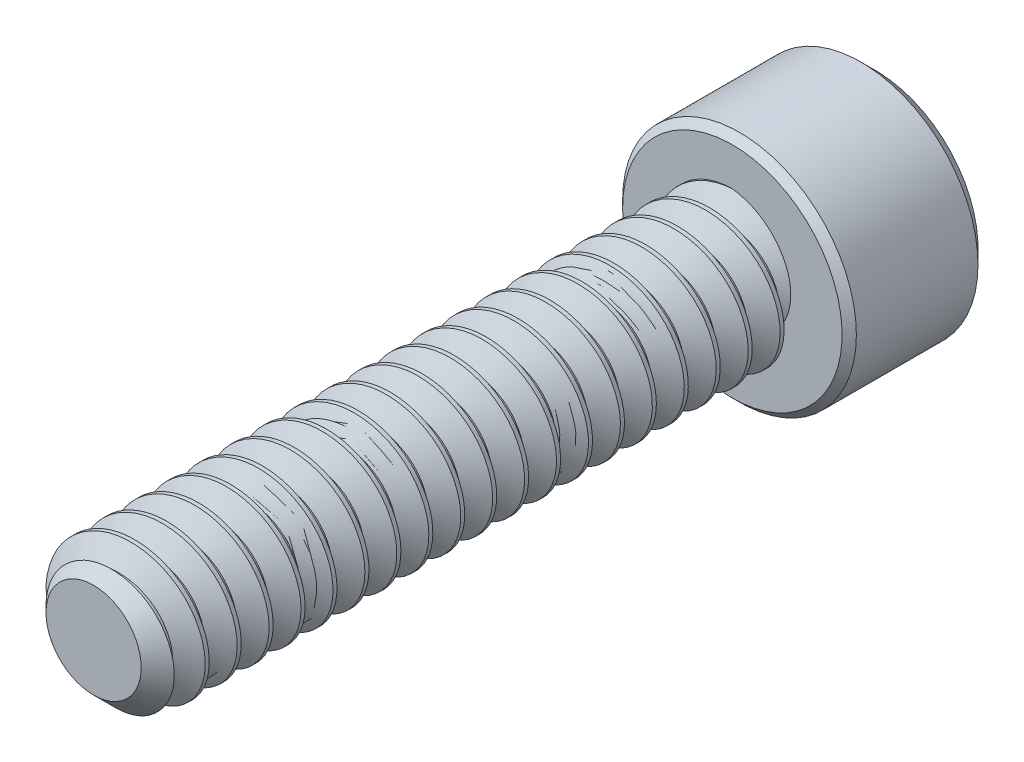
from build123d import *

# Parameters (mm, degrees)
SKETCH1_R          = 1.4224
EXTRUDE1_DEPTH     = 12.7
CHAMFER3_SIZE      = 0.47625
CUT_SWEEP1_PITCH   = 0.635
SKETCH6_R          = 2.3241
EXTRUDE2_DEPTH     = 2.8448
CUT_EXTRUDE1_DEPTH = 1.7859375
SKETCH8_R          = 1.374815329
CUT_EXTRUDE2_DEPTH = 0.28448
CUT_EXTRUDE2_DRAFT = -45
CHAMFER1_SIZE      = 0.28448
CHAMFER2_SIZE      = 0.14224


with BuildPart() as part:
    # Sketch1 → Extrude1 (new body)
    with BuildSketch(Plane.XY):
        Circle(SKETCH1_R)
    extrude(amount=-EXTRUDE1_DEPTH)

    # Chamfer3
    chamfer3_edges = [part.edges().sort_by_distance(p)[0] for p in [
        (-1.4224, 0, 0),
    ]]
    chamfer(chamfer3_edges, length=CHAMFER3_SIZE)

    # Cut-Sweep1: the profile of Sketch3 profile screwed along a right-hand helix of 21 turns, 6 arcs to a turn; built about Z, then put on its axis
    cut_sweep1_z = Axis((0, 0, 0), (0, 0, 1))
    cut_sweep1_corners = [(1.4227, 0, -0.555798205), (1.009955401, 0, -0.3175), (1.009955401, 0, -0.238125), (1.4227, 0, 0.000173205)]
    with BuildLine(mode=Mode.PRIVATE) as cut_sweep1_profile:
        Line(cut_sweep1_corners[0], cut_sweep1_corners[1])
        Line(cut_sweep1_corners[1], cut_sweep1_corners[2])
        Line(cut_sweep1_corners[2], cut_sweep1_corners[3])
        Line(cut_sweep1_corners[3], cut_sweep1_corners[0])
    cut_sweep1_cap = Face(cut_sweep1_profile.wire())
    cut_sweep1_turn_angles = [0, 30, 60, 90, 120, 150, 180, 210, 240, 270, 300, 330, 360]
    cut_sweep1_turn_weights = [1, 0.8660254037844387, 1, 0.8660254037844387, 1, 0.8660254037844387, 1, 0.8660254037844387, 1, 0.8660254037844387, 1, 0.8660254037844387, 1]
    cut_sweep1_turn_rails = [Edge.make_bspline([Vector(p[0], p[1], 0).rotate(cut_sweep1_z, cut_sweep1_turn_angles[k]) / cut_sweep1_turn_weights[k] + Vector(0, 0, p[2] + CUT_SWEEP1_PITCH * cut_sweep1_turn_angles[k] / 360) for k in range(13)], [0, 0, 0, 1, 1, 2, 2, 3, 3, 4, 4, 5, 5, 6, 6, 6], 2, cut_sweep1_turn_weights) for p in cut_sweep1_corners]
    cut_sweep1_turn_sides = [Face.make_surface_from_curves(cut_sweep1_turn_rails[p[0]], cut_sweep1_turn_rails[p[1]]) for p in [(0, 1), (1, 2), (2, 3), (3, 0)]]
    cut_sweep1 = Plane(origin=(0, 0, 0), x_dir=(0, 1, 0), z_dir=(0, 0, -1)) * Solid(Shell([*[p.moved(Location((0, 0, CUT_SWEEP1_PITCH * i))) for i in range(21) for p in cut_sweep1_turn_sides], cut_sweep1_cap, cut_sweep1_cap.rotate(cut_sweep1_z, 7560).moved(Location((0, 0, CUT_SWEEP1_PITCH * 7560 / 360)))]))
    add(cut_sweep1, mode=Mode.SUBTRACT)

    # Sketch6 → Extrude2 (add)
    with BuildSketch(Plane(origin=(0, 0, -12.7), x_dir=(-1, 0, 0), z_dir=(0, 0, -1))):
        Circle(SKETCH6_R)
    extrude(amount=EXTRUDE2_DEPTH)

    # Sketch7 → Cut-Extrude1 (cut)
    with BuildSketch(Plane(origin=(0, 0, -15.5448), x_dir=(-1, 0, 0), z_dir=(0, 0, -1))):
        Polygon((0, 1.374815329), (-1.190625, 0.687407664), (-1.190625, -0.687407664), (0, -1.374815329), (1.190625, -0.687407664), (1.190625, 0.687407664), align=None)
    extrude(amount=-CUT_EXTRUDE1_DEPTH, mode=Mode.SUBTRACT)


with BuildPart() as cut_extrude2_tool:
    # Sketch8 → Cut-Extrude2 (with draft: the straight prism first)
    with BuildSketch(Plane(origin=(0, 0, -15.5448), x_dir=(-1, 0, 0), z_dir=(0, 0, -1))):
        Circle(SKETCH8_R)
    extrude(amount=-CUT_EXTRUDE2_DEPTH)
    # Cut-Extrude2: the draft: its side faces are tilted about the plane it starts from
    cut_extrude2_sides = [cut_extrude2_tool.faces().sort_by_distance(p)[0] for p in [
        (1.374815329, 0, -15.40256),
    ]]
    draft(cut_extrude2_sides, Plane(origin=(0, 0, -15.5448), x_dir=(-1, 0, 0), z_dir=(0, 0, -1)), CUT_EXTRUDE2_DRAFT)


with BuildPart() as part_1:
    add(part.part)

    # Cut-Extrude2: cut by cut_extrude2_tool
    add(cut_extrude2_tool.part, mode=Mode.SUBTRACT)

    # Chamfer1
    chamfer1_edges = [part_1.edges().sort_by_distance(p)[0] for p in [
        (2.3241, 0, -15.5448),
    ]]
    chamfer(chamfer1_edges, length=CHAMFER1_SIZE)

    # Chamfer2
    chamfer2_edges = [part_1.edges().sort_by_distance(p)[0] for p in [
        (2.3241, 0, -12.7),
    ]]
    chamfer(chamfer2_edges, length=CHAMFER2_SIZE)


solid = part_1.part
